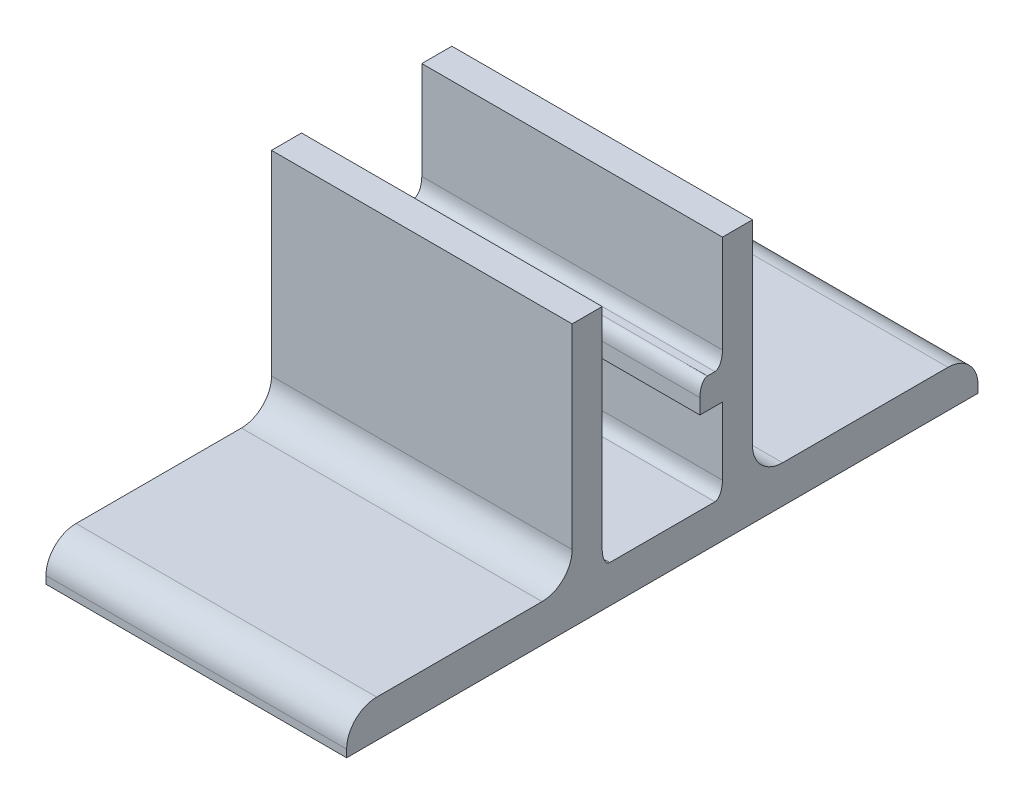
from build123d import *

# Parameters (mm, degrees)
BOSS_EXTRUDE1_DEPTH = 50.8
SKETCH4_W           = 3.81
SKETCH4_H           = 5.08
BOSS_EXTRUDE5_DEPTH = 50.8
FILLET1_R           = 5.08
FILLET2_SIZE        = 1.27
FILLET2_SIZE_2      = 2.54


with BuildPart() as part:
    # Sketch1 → Boss-Extrude1 (new body)
    with BuildSketch(Plane(origin=(0, 0, 0), x_dir=(0, 0, -1), z_dir=(1, 0, 0))):
        Polygon((0, 0), (106.68, 0), (106.68, 6.35), (68.58, 6.35), (68.58, 44.45), (63.5, 44.45), (63.5, 6.35), (43.18, 6.35), (43.18, 44.45), (38.1, 44.45), (38.1, 6.35), (0, 6.35), align=None)
    extrude(amount=BOSS_EXTRUDE1_DEPTH)

    # Sketch4 → Boss-Extrude5 (add)
    with BuildSketch(Plane(origin=(50.8, 0, 0), x_dir=(0, 0, -1), z_dir=(1, 0, 0))):
        with Locations((61.595, 22.86)):
            Rectangle(SKETCH4_W, SKETCH4_H)
    extrude(amount=-BOSS_EXTRUDE5_DEPTH)

    # Fillet1
    fillet1_edges = [part.edges().sort_by_distance(p)[0] for p in [
        (25.4, 6.35, 0),
        (25.4, 6.35, -38.1),
        (25.4, 6.35, -68.58),
        (25.4, 6.35, -106.68),
    ]]
    fillet(fillet1_edges, radius=FILLET1_R)

    # Fillet2
    # an asymmetric fillet: 2.54, 1.27 mm, written as the material it adds along each edge
    with BuildSketch(Plane(origin=(0, 6.35, -63.5), x_dir=(0, 0, 1), z_dir=(1, 0, 0))) as fillet2_piece_1:
        with BuildLine():
            Bezier((FILLET2_SIZE, 0), (0, 0), (0, -FILLET2_SIZE_2), weights=[1, 0.707106781, 1])
            Line((0, -FILLET2_SIZE_2), (0, 0))
            Line((0, 0), (FILLET2_SIZE, 0))
        make_face()
    extrude(amount=50.8)
    with BuildSketch(Plane(origin=(0, 6.35, -43.18), x_dir=(0, 1, 0), z_dir=(1, 0, 0)), Plane(origin=(50.8, 25.4, -63.5), x_dir=(0, 1, 0), z_dir=(-1, 0, 0))) as fillet2_piece_2:
        with BuildLine():
            Bezier((FILLET2_SIZE_2, 0), (0, 0), (0, -FILLET2_SIZE), weights=[1, 0.707106781, 1])
            Line((0, -FILLET2_SIZE), (0, 0))
            Line((0, 0), (FILLET2_SIZE_2, 0))
        make_face()
    extrude(amount=50.8)
    # an asymmetric fillet: 2.54, 1.27 mm, written as the material it takes off along each edge
    with BuildSketch(Plane(origin=(57.15, 25.4, -59.69), x_dir=(0, 0, -1), z_dir=(-1, 0, 0))) as fillet2_2_piece_1:
        with BuildLine():
            Bezier((FILLET2_SIZE, 0), (0, 0), (0, FILLET2_SIZE_2), weights=[1, 0.707106781, 1])
            Line((0, FILLET2_SIZE_2), (0, 0))
            Line((0, 0), (FILLET2_SIZE, 0))
        make_face()
    extrude(amount=63.5, mode=Mode.SUBTRACT)


solid = part.part
